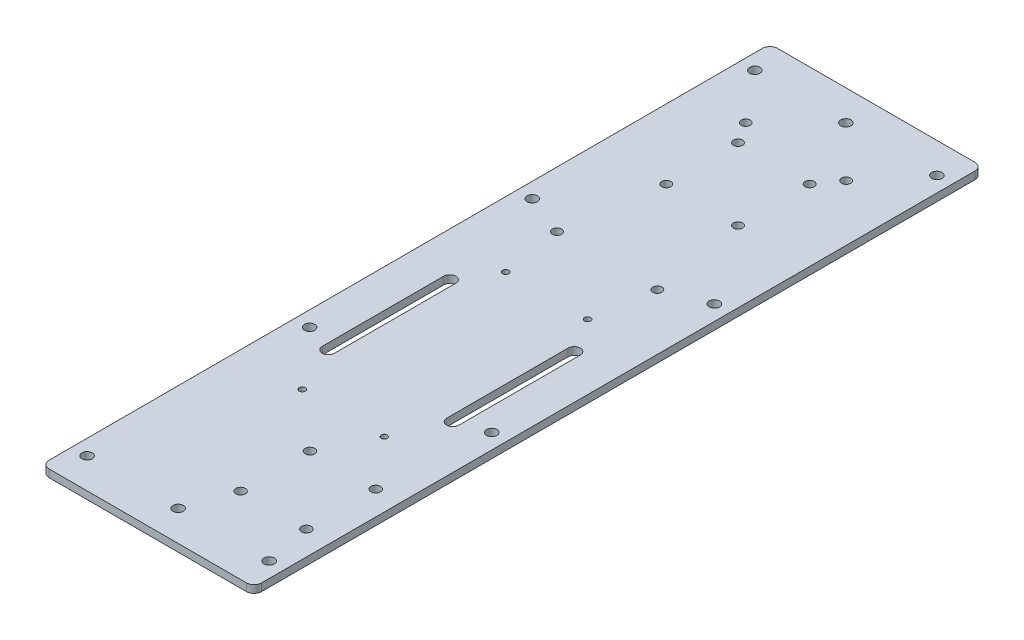
from build123d import *

# Parameters (mm, degrees)
PLATE_THICKNESS_DEPTH        = 3.175
SKETCH3_R                    = 2.159
MOUNTING_HOLES_DEPTH         = 159.781746826
SKETCH4_R                    = 1.905
JETSON_HOLES_W_O_MOUNT_DEPTH = 159.781746826
SKETCH5_R                    = 1.905
PDB_HOLES_DEPTH              = 159.781746826
SKETCH7_R                    = 1.27
PIXHAWK_HOLES_DEPTH          = 159.781746826
BATTERY_HOLES_DEPTH          = 159.781746826
SKETCH9_R                    = 2
CUT_EXTRUDE1_DEPTH           = 159.781746826


with BuildPart() as part:
    # Sketch2 → Plate Thickness (new body)
    with BuildSketch(Plane(origin=(0, 0, 0), x_dir=(1, 0, 0), z_dir=(0, 1, 0))):
        with BuildLine():
            Line((-41.275, 152.4), (41.275, 152.4))
            ThreePointArc((41.275, 152.4), (43.52006403, 151.47006403), (44.45, 149.225))
            Line((44.45, 149.225), (44.45, -149.225))
            ThreePointArc((44.45, -149.225), (43.52006403, -151.47006403), (41.275, -152.4))
            Line((41.275, -152.4), (-41.275, -152.4))
            ThreePointArc((-41.275, -152.4), (-43.52006403, -151.47006403), (-44.45, -149.225))
            Line((-44.45, -149.225), (-44.45, 149.225))
            ThreePointArc((-44.45, 149.225), (-43.52006403, 151.47006403), (-41.275, 152.4))
        make_face()
    extrude(amount=PLATE_THICKNESS_DEPTH)

    # Sketch3 → Mounting holes (cut, through all)
    with BuildSketch(Plane(origin=(0, 3.175, 0), x_dir=(1, 0, 0), z_dir=(0, 1, 0))):
        with Locations((-38.1, 139.7)):
            Circle(SKETCH3_R)
        with Locations((-38.1, 46.566666666)):
            Circle(SKETCH3_R)
        with Locations((-38.1, -46.56666582)):
            Circle(SKETCH3_R)
        with Locations((-38.1, -139.7)):
            Circle(SKETCH3_R)
        with Locations((38.1, -139.7)):
            Circle(SKETCH3_R)
        with Locations((38.1, -46.56666582)):
            Circle(SKETCH3_R)
        with Locations((38.1, 46.566666666)):
            Circle(SKETCH3_R)
        with Locations((38.1, 139.7)):
            Circle(SKETCH3_R)
        with Locations((0, 139.7)):
            Circle(SKETCH3_R)
        with Locations((0, -139.7)):
            Circle(SKETCH3_R)
    extrude(amount=-MOUNTING_HOLES_DEPTH, mode=Mode.SUBTRACT)

    # Sketch4 → Jetson Holes (w/o mount) (cut, through all)
    with BuildSketch(Plane(origin=(0, 3.175, 0), x_dir=(1, 0, 0), z_dir=(0, 1, 0))):
        with Locations((-21.0058, 118.808268359)):
            Circle(SKETCH4_R)
        with Locations((-21.0058, 39.814268359)):
            Circle(SKETCH4_R)
        with Locations((21.0058, 39.814268359)):
            Circle(SKETCH4_R)
        with Locations((21.0058, 118.808268359)):
            Circle(SKETCH4_R)
    extrude(amount=-JETSON_HOLES_W_O_MOUNT_DEPTH, mode=Mode.SUBTRACT)

    # Sketch5 → PDB holes (cut, through all)
    with BuildSketch(Plane(origin=(0, 3.175, 0), x_dir=(1, 0, 0), z_dir=(0, 1, 0))):
        with Locations((-15.378405846, 109.933938224)):
            Circle(SKETCH5_R)
        with Locations((14.618994154, 109.933938224)):
            Circle(SKETCH5_R)
        with Locations((14.618994154, 79.936538224)):
            Circle(SKETCH5_R)
        with Locations((-15.378405846, 79.936538224)):
            Circle(SKETCH5_R)
    extrude(amount=-PDB_HOLES_DEPTH, mode=Mode.SUBTRACT)

    # Sketch7 → PixHawk Holes (cut, through all)
    with BuildSketch(Plane(origin=(0, 3.175, 0), x_dir=(1, 0, 0), z_dir=(0, 1, 0))):
        with Locations((-17.145, 14.489268954)):
            Circle(SKETCH7_R)
        with Locations((-17.145, -70.600731046)):
            Circle(SKETCH7_R)
        with Locations((17.145, -70.600731046)):
            Circle(SKETCH7_R)
        with Locations((17.145, 14.489268954)):
            Circle(SKETCH7_R)
    extrude(amount=-PIXHAWK_HOLES_DEPTH, mode=Mode.SUBTRACT)

    # Sketch8 → Battery Holes (cut, through all)
    with BuildSketch(Plane(origin=(0, 3.175, 0), x_dir=(1, 0, 0), z_dir=(0, 1, 0))):
        with BuildLine():
            Line((-23.495, -0.005964701), (-23.495, -50.805964701))
            ThreePointArc((-23.495, -50.805964701), (-26.035, -53.345964701), (-28.575, -50.805964701))
            Line((-28.575, -50.805964701), (-28.575, -0.005964701))
            ThreePointArc((-28.575, -0.005964701), (-26.035, 2.534035299), (-23.495, -0.005964701))
        make_face()
        with BuildLine():
            Line((23.495, -0.005964701), (23.495, -50.805964701))
            ThreePointArc((23.495, -50.805964701), (26.035, -53.345964701), (28.575, -50.805964701))
            Line((28.575, -50.805964701), (28.575, -0.005964701))
            ThreePointArc((28.575, -0.005964701), (26.035, 2.534035299), (23.495, -0.005964701))
        make_face()
    extrude(amount=-BATTERY_HOLES_DEPTH, mode=Mode.SUBTRACT)

    # Sketch9 → Cut-Extrude1 (cut, through all)
    with BuildSketch(Plane(origin=(0, 3.175, 0), x_dir=(1, 0, 0), z_dir=(0, 1, 0))):
        with Locations((6.833401633, -91.367433851)):
            Circle(SKETCH9_R)
        with Locations((34.333401633, -91.367433851)):
            Circle(SKETCH9_R)
        with Locations((34.333401633, -120.367433851)):
            Circle(SKETCH9_R)
        with Locations((6.833401633, -120.367433851)):
            Circle(SKETCH9_R)
    extrude(amount=-CUT_EXTRUDE1_DEPTH, mode=Mode.SUBTRACT)


solid = part.part
